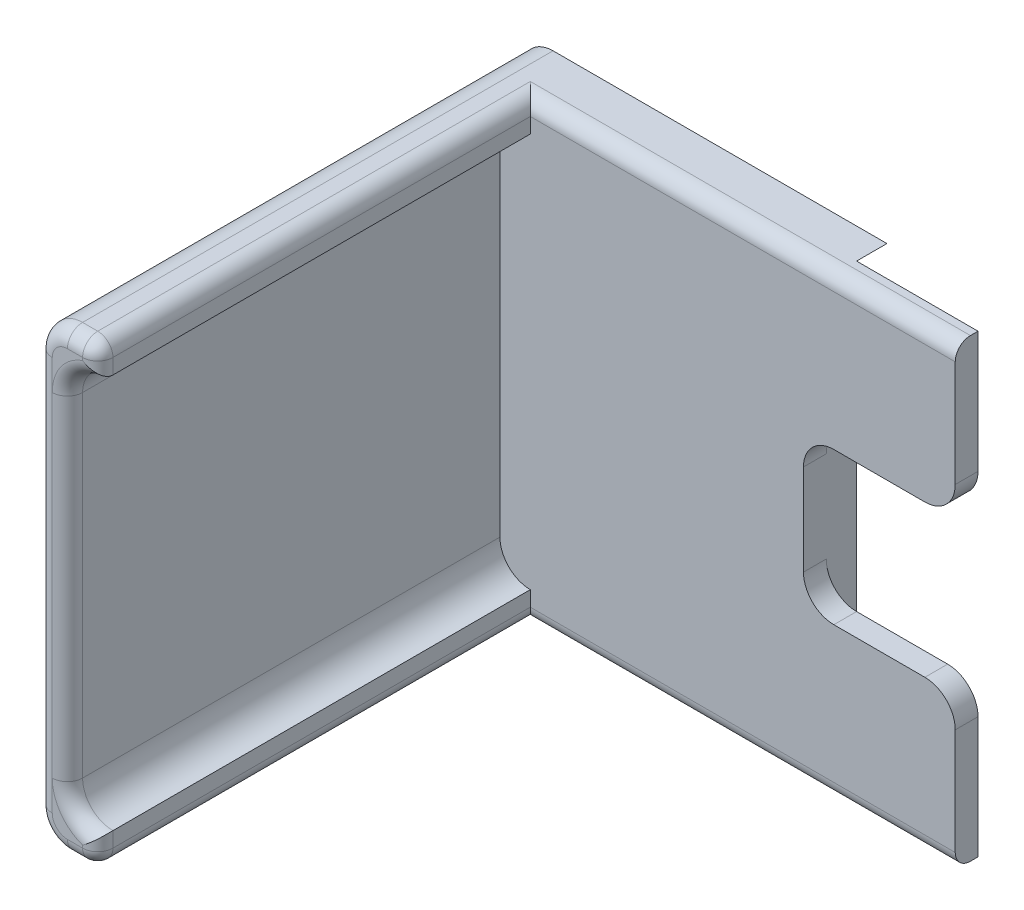
from build123d import *

# Parameters (mm, degrees)
BOSS_EXTRUDE1_DEPTH = 7.5
BOSS_EXTRUDE2_DEPTH = 150
BOSS_EXTRUDE3_START = -10
BOSS_EXTRUDE3_DEPTH = 10
FILLET1_R           = 5
FILLET2_R           = 10
FILLET3_R           = 10


with BuildPart() as part:
    # Sketch1 → Boss-Extrude1 (new body)
    with BuildSketch(Plane.XY):
        with BuildLine():
            Line((-40, 75), (-40, 65))
            ThreePointArc((-40, 65), (-47.071067812, 62.071067812), (-50, 55))
            Line((-50, 55), (-50, -55))
            ThreePointArc((-50, -55), (-47.071067812, -62.071067812), (-40, -65))
            Line((-40, -65), (-40, -75))
            Line((-40, -75), (100, -75))
            Line((100, -75), (100, -25))
            Line((100, -25), (50, -25))
            Line((50, -25), (50, 25))
            Line((50, 25), (100, 25))
            Line((100, 25), (100, 75))
            Line((100, 75), (-40, 75))
        make_face()
    extrude(amount=BOSS_EXTRUDE1_DEPTH)

    # Sketch1<5> → Boss-Extrude2 (add)
    with BuildSketch(Plane.XY):
        with BuildLine():
            ThreePointArc((-50, 55), (-47.071067812, 62.071067812), (-40, 65))
            Line((-40, 65), (-40, 75))
            Line((-40, 75), (-50, 75))
            ThreePointArc((-50, 75), (-57.071067812, 72.071067812), (-60, 65))
            Line((-60, 65), (-60, -65))
            ThreePointArc((-60, -65), (-57.071067812, -72.071067812), (-50, -75))
            Line((-50, -75), (-40, -75))
            Line((-40, -75), (-40, -65))
            ThreePointArc((-40, -65), (-47.071067812, -62.071067812), (-50, -55))
            Line((-50, -55), (-50, 55))
        make_face()
    extrude(amount=BOSS_EXTRUDE2_DEPTH)

    # Sketch1<6> → Boss-Extrude3 (add)
    with BuildSketch(Plane.XY.offset(BOSS_EXTRUDE3_START)):
        with BuildLine():
            Line((-50, -75), (60, -75))
            ThreePointArc((60, -75), (52.928932188, -72.071067812), (50, -65))
            Line((50, -65), (50, 65))
            ThreePointArc((50, 65), (52.928932188, 72.071067812), (60, 75))
            Line((60, 75), (-50, 75))
            ThreePointArc((-50, 75), (-57.071067812, 72.071067812), (-60, 65))
            Line((-60, 65), (-60, -65))
            ThreePointArc((-60, -65), (-57.071067812, -72.071067812), (-50, -75))
        make_face()
    extrude(amount=BOSS_EXTRUDE3_DEPTH)

    # Fillet1
    fillet1_edges = [part.edges().sort_by_distance(p)[0] for p in [
        (30, 75, 7.5),
        (-57.071067812, -72.071067812, 150),
        (30, -75, 7.5),
        (-40, -75, 78.75),
        (-40, -70, 150),
        (-47.071067812, -62.071067812, 150),
        (-45, 75, 150),
        (-40, 75, 78.75),
        (-57.071067812, 72.071067812, 150),
        (-60, 0, 150),
        (-45, -75, 150),
        (-50, 0, 150),
        (-47.071067812, 62.071067812, 150),
        (-40, 70, 150),
    ]]
    fillet(fillet1_edges, radius=FILLET1_R - 0.0001)  # a hair under: the kernel refuses the full size

    # Fillet2
    fillet2_edges = [part.edges().sort_by_distance(p)[0] for p in [
        (100, 25, 3.75),
        (100, -25, 3.75),
    ]]
    fillet(fillet2_edges, radius=FILLET2_R)

    # Fillet3
    fillet3_edges = [part.edges().sort_by_distance(p)[0] for p in [
        (50, 25, 3.75),
        (50, -25, 3.75),
    ]]
    fillet(fillet3_edges, radius=FILLET3_R)


solid = part.part
